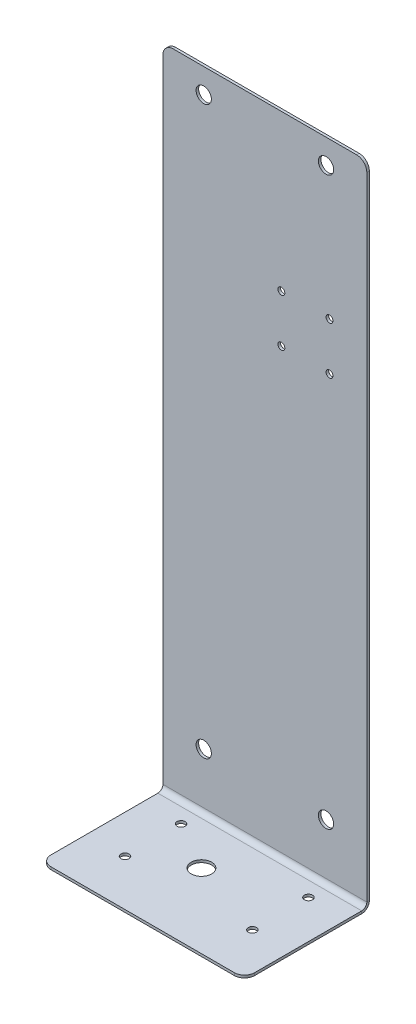
from build123d import *

# Parameters (mm, degrees)
SKETCH2_W            = 127
SKETCH2_H            = 406.4
BOSS_EXTRUDE1_DEPTH  = 3.175
SKETCH3_W            = 127
SKETCH3_H            = 3.175
BOSS_EXTRUDE2_DEPTH  = 76.2
FILLET1_R            = 3.175
FILLET2_R            = 6.35
SKETCH4_R            = 6.35
SKETCH4_R_2          = 2.54
CUT_EXTRUDE1_DEPTH   = 416.840163104
SKETCH5_R            = 2.15
SKETCH5_R_2          = 4.7625
CUT_EXTRUDE2_DEPTH   = 227.117071448
CONVERT_SOLID1_START = -63.5
CONVERT_SOLID1_DEPTH = 127


# Read off the part's stored shape, not the designer's step: Convert-Solid1
with BuildPart() as part:
    # Sketch2 → Boss-Extrude1 (new body)
    with BuildSketch(Plane.XY):
        Rectangle(SKETCH2_W, SKETCH2_H)
    extrude(amount=BOSS_EXTRUDE1_DEPTH)

    # Sketch3 → Boss-Extrude2 (add)
    with BuildSketch(Plane.XY.offset(3.175)):
        with Locations((0, -201.6125)):
            Rectangle(SKETCH3_W, SKETCH3_H)
    extrude(amount=BOSS_EXTRUDE2_DEPTH)

    # Fillet1
    fillet1_edges = [part.edges().sort_by_distance(p)[0] for p in [
        (0, -200.025, 3.175),
        (0, -203.2, 0),
    ]]
    fillet(fillet1_edges, radius=FILLET1_R)

    # Fillet2
    fillet2_edges = [part.edges().sort_by_distance(p)[0] for p in [
        (-63.5, -201.6125, 79.375),
        (63.5, -201.6125, 79.375),
        (-63.5, 203.2, 1.5875),
        (63.5, 203.2, 1.5875),
    ]]
    fillet(fillet2_edges, radius=FILLET2_R)

    # Sketch4 → Cut-Extrude1 (cut, through all)
    with BuildSketch(Plane(origin=(0, -200.025, 0), x_dir=(1, 0, 0), z_dir=(0, 1, 0))):
        with Locations(Location((-9.525, -33.175, 0), (0, 0, 270))):
            Circle(SKETCH4_R)
        with Locations(Location((-39.6875, -15.7125, 0), (0, 0, 270))):
            Circle(SKETCH4_R_2)
        with Locations(Location((-39.6875, -50.6375, 0), (0, 0, 270))):
            Circle(SKETCH4_R_2)
        with Locations(Location((39.6875, -15.7125, 0), (0, 0, 270))):
            Circle(SKETCH4_R_2)
        with Locations(Location((39.6875, -50.6375, 0), (0, 0, 270))):
            Circle(SKETCH4_R_2)
    extrude(amount=-CUT_EXTRUDE1_DEPTH, mode=Mode.SUBTRACT)

    # Sketch5 → Cut-Extrude2 (cut, through all)
    with BuildSketch(Plane.XY.offset(3.175)):
        with Locations((10.273, 76.475)):
            Circle(SKETCH5_R)
        with Locations((40.273, 76.475)):
            Circle(SKETCH5_R)
        with Locations((40.273, 106.175)):
            Circle(SKETCH5_R)
        with Locations((10.273, 106.175)):
            Circle(SKETCH5_R)
        with Locations((-38.1, 187.96)):
            Circle(SKETCH5_R_2)
        with Locations((38.1, 187.96)):
            Circle(SKETCH5_R_2)
        with Locations((-38.1, -165.1)):
            Circle(SKETCH5_R_2)
        with Locations((38.1, -165.1)):
            Circle(SKETCH5_R_2)
    extrude(amount=-CUT_EXTRUDE2_DEPTH, mode=Mode.SUBTRACT)

    # Convert-Solid1 outline → Convert-Solid1 (cut)
    with BuildSketch(Plane.YZ.offset(CONVERT_SOLID1_START)):
        with BuildLine():
            ThreePointArc((-196.85, 1.5875), (-200.217596045, 2.982403955), (-201.6125, 6.35))
            Line((-201.6125, 6.35), (-201.6125, 79.375))
            Line((-201.6125, 79.375), (-203.2, 79.375))
            Line((-203.2, 79.375), (-203.2, 3.175))
            ThreePointArc((-203.2, 3.175), (-202.27006403, 0.92993597), (-200.025, 0))
            Line((-200.025, 0), (203.2, 0))
            Line((203.2, 0), (203.2, 1.5875))
            Line((203.2, 1.5875), (-196.85, 1.5875))
        make_face()
    extrude(amount=CONVERT_SOLID1_DEPTH, mode=Mode.SUBTRACT)


solid = part.part
